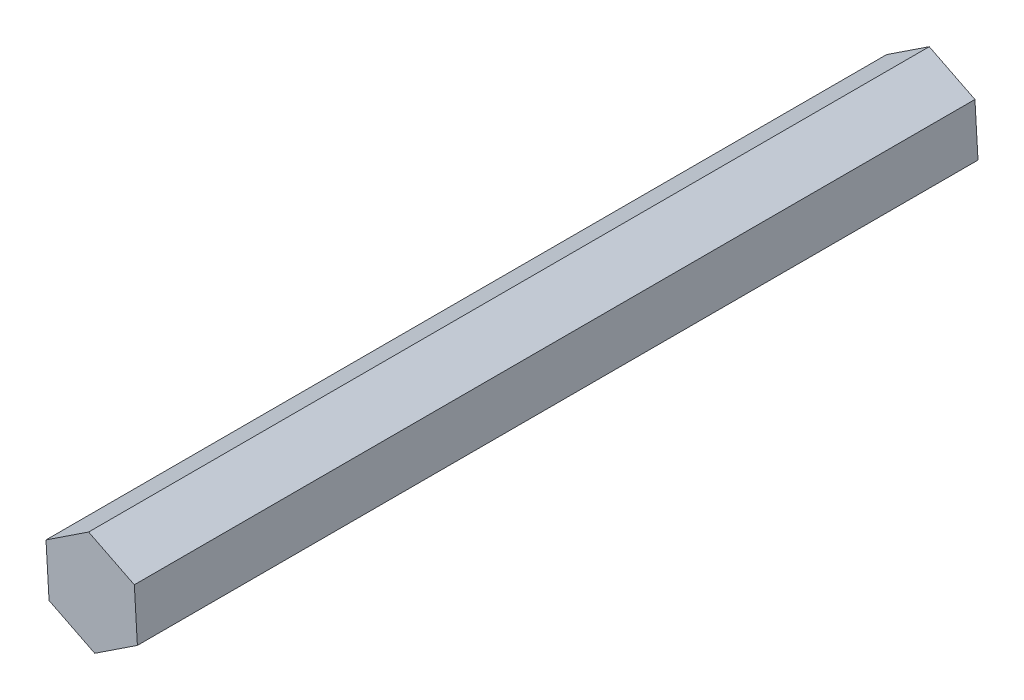
from build123d import *

# Parameters (mm, degrees)
BOSS_EXTRUDE1_DEPTH = 120.65


with BuildPart() as part:
    # Sketch1 → Boss-Extrude1 (new body)
    with BuildSketch(Plane.XY):
        Polygon((-6.5582518, 3.2791259), (-6.118932231, -4.040049713), (0.439319568, -7.319175613), (6.5582518, -3.2791259), (6.118932231, 4.040049713), (-0.439319568, 7.319175613), align=None)
    extrude(amount=BOSS_EXTRUDE1_DEPTH)


solid = part.part
